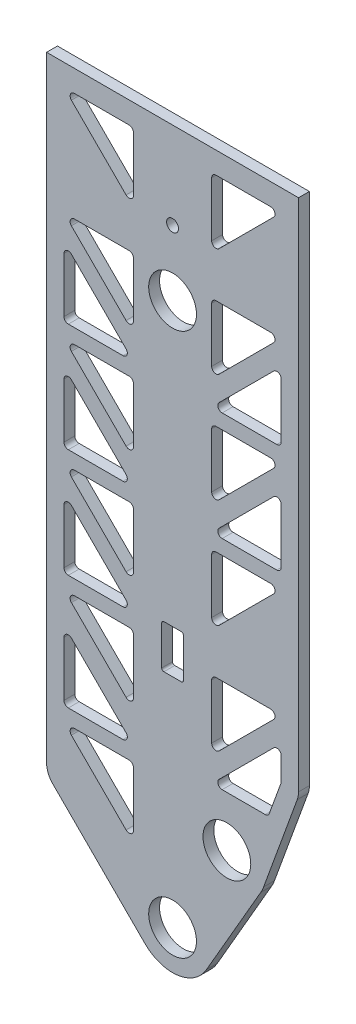
from build123d import *

# Parameters (mm, degrees)
SKETCH_1_R                  = 11
EXTRUDE_565_DEPTH           = 100
EXTRUDE_START               = -100
SKETCH_2_R                  = 11
EXTRUDE_874_DEPTH           = 100
EXTRUDE_2690_DEPTH          = 100
CUT_EXTRUDE_4147_DEPTH      = 534.010318849
CUT_EXTRUDE_4147_DEPTH_BACK = 534.010318849
SKETCH_3_W                  = 90
SKETCH_3_H                  = 380
SKETCH_5_R                  = 2.5
EXTRUDE_4713_DEPTH          = 100
SKETCH_6_W                  = 191.177045066
SKETCH_6_H                  = 235.084722287
CUT_EXTRUDE_5027_DEPTH      = 84
SKETCH_7_R                  = 75
EXTRUDE_5315_DEPTH          = 5
CUT_EXTRUDE_6097_DEPTH      = 357.195171219
CUT_EXTRUDE_6097_DEPTH_BACK = 357.195171219
FILLET_2_R                  = 2
MIRROR_START                = 95
MIRROR_1_DEPTH              = 5
CUT_EXTRUDE_START           = -5
CUT_EXTRUDE_12029_OUTLINE_R = 5
CUT_EXTRUDE_12029_DEPTH     = 5
CUT_EXTRUDE_7_DEPTH         = 357.195171219
CUT_EXTRUDE_7_DEPTH_BACK    = 357.195171219
SKETCH_14_W                 = 10
SKETCH_14_H                 = 20
FILLET_4_R                  = 1
CUT_EXTRUDE_START_2         = -129
SKETCH_15_R                 = 11
CUT_EXTRUDE_8_DEPTH         = 129
SKETCH_16_R                 = 13
CUT_EXTRUDE_9_DEPTH         = 0.75
SKETCH_18_R                 = 11
CUT_EXTRUDE_11_DEPTH        = 113
CUT_EXTRUDE_12_DEPTH        = 357.195171219
CUT_EXTRUDE_12_DEPTH_BACK   = 357.195171219
MOVE_FACE_1_BY              = 4
SKETCH_22_R                 = 2.75
CUT_EXTRUDE_14_DEPTH        = 22
FILLET_5_R                  = 10
MOVE_FACE_2_BY              = 4


# Read off the part's stored shape, not the designer's step: 镜向1, 电机安装轴承孔
with BuildPart() as part:
    # 草图1 → Extrude 565 (new body)
    with BuildSketch(Plane.XY):
        with BuildLine():
            Line((-18, 500), (-18, 0))
            ThreePointArc((-18, 0), (0, -18), (18, 0))
            Line((18, 0), (18, 500))
            ThreePointArc((18, 500), (0, 518), (-18, 500))
        make_face()
        with Locations((0, 500)):
            Circle(SKETCH_1_R, mode=Mode.SUBTRACT)
        Circle(SKETCH_1_R, mode=Mode.SUBTRACT)
    extrude(amount=EXTRUDE_565_DEPTH)

    # 草图2 → Extrude 874 (add)
    with BuildSketch(Plane.XY.offset(100).offset(EXTRUDE_START)):
        with BuildLine():
            Line((18, 61.301270189), (25, 61.301270189))
            ThreePointArc((25, 61.301270189), (40.588457268, 52.301270189), (40.588457268, 34.301270189))
            Line((40.588457268, 34.301270189), (15.588457268, -9))
            ThreePointArc((15.588457268, -9), (-4.658742812, -17.386664873), (-18, 0))
            Line((-18, 0), (-18, 61.301270189))
            Line((-18, 61.301270189), (18, 61.301270189))
        make_face()
        with Locations((25, 43.301270189)):
            Circle(SKETCH_2_R, mode=Mode.SUBTRACT)
        Circle(SKETCH_2_R, mode=Mode.SUBTRACT)
    extrude(amount=EXTRUDE_874_DEPTH)

    # 草图10 → Extrude 2690 (add)
    with BuildSketch(Plane(origin=(0, 0, 0), x_dir=(-1, 0, 0), z_dir=(0, 0, -1))):
        with BuildLine():
            Line((-41.914467174, 37.144907609), (-58, 81.339545828))
            Line((-58, 81.339545828), (-58, 320))
            Line((-58, 320), (-18, 320))
            Line((-18, 320), (-18, 61.301270189))
            Line((-18, 61.301270189), (-25, 61.301270189))
            ThreePointArc((-25, 61.301270189), (-39.744736797, 53.625646044), (-41.914467174, 37.144907609))
        make_face()
        with BuildLine():
            Line((12.727922061, -12.727922061), (58, 32.544155877))
            Line((58, 32.544155877), (58, 320))
            Line((58, 320), (18, 320))
            Line((18, 320), (18, 0))
            ThreePointArc((18, 0), (16.629831585, -6.888301783), (12.727922061, -12.727922061))
        make_face()
    extrude(amount=-EXTRUDE_2690_DEPTH)

    # 草图3 → Cut-Extrude 4147 (cut, two sides: drawn at the far end of the back side and taken through both)
    with BuildSketch(Plane.ZY.offset(18).offset(-CUT_EXTRUDE_4147_DEPTH_BACK)):
        with Locations((50, 150)):
            Rectangle(SKETCH_3_W, SKETCH_3_H)
    extrude(amount=CUT_EXTRUDE_4147_DEPTH + CUT_EXTRUDE_4147_DEPTH_BACK, mode=Mode.SUBTRACT)

    # 草图5 → Extrude 4713 (add)
    with BuildSketch(Plane.XY.offset(100)):
        with Locations(Location((0, 250, 0), (0, 0, 90))):
            Circle(SKETCH_5_R)
    extrude(amount=-EXTRUDE_4713_DEPTH)

    # 草图6 → Cut-Extrude 5027 (cut)
    with BuildSketch(Plane(origin=(18, 0, 0), x_dir=(0, 0, -1), z_dir=(1, 0, 0))):
        with Locations((-50.962374235, 437.542361144)):
            Rectangle(SKETCH_6_W, SKETCH_6_H)
    extrude(amount=-CUT_EXTRUDE_5027_DEPTH, mode=Mode.SUBTRACT)

    # 草图7 → Extrude 5315 (add)
    with BuildSketch(Plane(origin=(0, 320, 0), x_dir=(1, 0, 0), z_dir=(0, 1, 0))):
        with Locations(Location((0, -50, 0), (0, 0, 320.654170234))):
            Circle(SKETCH_7_R)
    extrude(amount=EXTRUDE_5315_DEPTH)

    # 草图10<3> → Cut-Extrude 6097 (cut, two sides: drawn at the far end of the back side and taken through both)
    with BuildSketch(Plane(origin=(0, 0, 0), x_dir=(-1, 0, 0), z_dir=(0, 0, -1)).offset(-CUT_EXTRUDE_6097_DEPTH_BACK)):
        Polygon((50, 310), (18, 310), (18, 278), align=None)
        Polygon((-18, 278), (-18, 310), (-50, 310), align=None)
        Polygon((-18, 227.925713543), (-18, 259.925713543), (-50, 259.925713543), align=None)
        Polygon((50, 259.925713543), (18, 259.925713543), (18, 227.925713543), align=None)
        Polygon((50, 248.612005044), (50, 216.612005044), (18, 216.612005044), align=None)
        Polygon((-50, 248.612005044), (-50, 216.612005044), (-18, 216.612005044), align=None)
        Polygon((-18, 177.851427085), (-18, 209.851427085), (-50, 209.851427085), align=None)
        Polygon((50, 209.851427085), (18, 209.851427085), (18, 177.851427085), align=None)
        Polygon((50, 198.537718586), (50, 166.537718586), (18, 166.537718586), align=None)
        Polygon((-50, 198.537718586), (-50, 166.537718586), (-18, 166.537718586), align=None)
        Polygon((-50, 159.777140628), (-18, 127.777140628), (-18, 159.777140628), align=None)
        Polygon((18, 159.777140628), (18, 127.777140628), (50, 159.777140628), align=None)
        Polygon((-50, 109.702854171), (-18, 77.702854171), (-18, 109.702854171), align=None)
        Polygon((18, 109.702854171), (18, 77.702854171), (50, 109.702854171), align=None)
        Polygon((-50, 98.389145672), (-50, 82.750161674), (-44.045077173, 66.389145672), (-18, 66.389145672), align=None)
        Polygon((18, 56.800140588), (18, 24.800140588), (50, 56.800140588), align=None)
        Polygon((50, 95.560718547), (50, 63.560718547), (18, 63.560718547), align=None)
        Polygon((50, 116.463432129), (18, 116.463432129), (50, 148.463432129), align=None)
    extrude(amount=CUT_EXTRUDE_6097_DEPTH + CUT_EXTRUDE_6097_DEPTH_BACK, mode=Mode.SUBTRACT)

    # 圆角2
    fillet_2_edges = [part.edges().sort_by_distance(p)[0] for p in [
        (50, 109.702854171, 2.5),
        (18, 109.702854171, 2.5),
        (18, 77.702854171, 2.5),
        (-18, 159.777140628, 2.5),
        (-50, 159.777140628, 2.5),
        (-18, 127.777140628, 2.5),
        (50, 159.777140628, 2.5),
        (18, 159.777140628, 2.5),
        (18, 127.777140628, 2.5),
        (50, 166.537718586, 2.5),
        (50, 198.537718586, 2.5),
        (18, 166.537718586, 2.5),
        (-50, 63.560718547, 2.5),
        (-18, 63.560718547, 2.5),
        (-50, 95.560718547, 2.5),
        (-50, 56.800140588, 2.5),
        (-18, 24.800140588, 2.5),
        (-18, 56.800140588, 2.5),
        (50, 82.750161674, 2.5),
        (50, 98.389145672, 2.5),
        (18, 66.389145672, 2.5),
        (44.045077173, 66.389145672, 2.5),
        (-18, 109.702854171, 2.5),
        (-50, 109.702854171, 2.5),
        (-18, 77.702854171, 2.5),
        (50, 310, 2.5),
        (18, 310, 2.5),
        (18, 278, 2.5),
        (50, 259.925713543, 2.5),
        (18, 259.925713543, 2.5),
        (18, 227.925713543, 2.5),
        (-50, 248.612005044, 2.5),
        (-50, 216.612005044, 2.5),
        (-18, 216.612005044, 2.5),
        (-18, 259.925713543, 2.5),
        (-50, 259.925713543, 2.5),
        (-18, 227.925713543, 2.5),
        (50, 216.612005044, 2.5),
        (50, 248.612005044, 2.5),
        (18, 216.612005044, 2.5),
        (50, 209.851427085, 2.5),
        (18, 209.851427085, 2.5),
        (18, 177.851427085, 2.5),
        (-50, 198.537718586, 2.5),
        (-50, 166.537718586, 2.5),
        (-18, 166.537718586, 2.5),
        (-18, 209.851427085, 2.5),
        (-50, 209.851427085, 2.5),
        (-18, 177.851427085, 2.5),
        (-50, 148.463432129, 2.5),
        (-50, 116.463432129, 2.5),
        (-18, 116.463432129, 2.5),
        (-18, 310, 2.5),
        (-50, 310, 2.5),
        (-18, 278, 2.5),
    ]]
    fillet(fillet_2_edges, radius=FILLET_2_R)

    # 镜向1 outline → 镜向1 (add)
    with BuildSketch(Plane.XY.offset(MIRROR_START)):
        with BuildLine():
            ThreePointArc((-50, 143.635005004), (-48.765366865, 145.482764069), (-46.585786438, 145.049218567))
            Line((-46.585786438, 145.049218567), (-50, 148.463432129))
            Line((-50, 148.463432129), (-50, 143.635005004))
        make_face()
        with BuildLine():
            Line((-18, 116.463432129), (-21.414213562, 119.877645691))
            ThreePointArc((-21.414213562, 119.877645691), (-20.98066806, 117.698065264), (-22.828427125, 116.463432129))
            Line((-22.828427125, 116.463432129), (-18, 116.463432129))
        make_face()
        with BuildLine():
            ThreePointArc((-48, 116.463432129), (-49.414213562, 117.049218567), (-50, 118.463432129))
            Line((-50, 118.463432129), (-50, 116.463432129))
            Line((-50, 116.463432129), (-48, 116.463432129))
        make_face()
        with BuildLine():
            ThreePointArc((-20, 310), (-18.585786438, 309.414213562), (-18, 308))
            Line((-18, 308), (-18, 310))
            Line((-18, 310), (-20, 310))
        make_face()
        with BuildLine():
            Line((-18, 278), (-18, 282.828427125))
            ThreePointArc((-18, 282.828427125), (-19.234633135, 280.98066806), (-21.414213562, 281.414213562))
            Line((-21.414213562, 281.414213562), (-18, 278))
        make_face()
        with BuildLine():
            ThreePointArc((-46.585786438, 306.585786438), (-47.01933194, 308.765366865), (-45.171572875, 310))
            Line((-45.171572875, 310), (-50, 310))
            Line((-50, 310), (-46.585786438, 306.585786438))
        make_face()
        with BuildLine():
            ThreePointArc((-20, 259.925713543), (-18.585786438, 259.339927105), (-18, 257.925713543))
            Line((-18, 257.925713543), (-18, 259.925713543))
            Line((-18, 259.925713543), (-20, 259.925713543))
        make_face()
        with BuildLine():
            Line((-18, 227.925713543), (-18, 232.754140667))
            ThreePointArc((-18, 232.754140667), (-19.234633135, 230.906381602), (-21.414213562, 231.339927105))
            Line((-21.414213562, 231.339927105), (-18, 227.925713543))
        make_face()
        with BuildLine():
            ThreePointArc((-46.585786438, 256.51149998), (-47.01933194, 258.691080407), (-45.171572875, 259.925713543))
            Line((-45.171572875, 259.925713543), (-50, 259.925713543))
            Line((-50, 259.925713543), (-46.585786438, 256.51149998))
        make_face()
        with BuildLine():
            ThreePointArc((-50, 243.783577919), (-48.765366865, 245.631336984), (-46.585786438, 245.197791481))
            Line((-46.585786438, 245.197791481), (-50, 248.612005044))
            Line((-50, 248.612005044), (-50, 243.783577919))
        make_face()
        with BuildLine():
            Line((-18, 216.612005044), (-21.414213562, 220.026218606))
            ThreePointArc((-21.414213562, 220.026218606), (-20.98066806, 217.846638179), (-22.828427125, 216.612005044))
            Line((-22.828427125, 216.612005044), (-18, 216.612005044))
        make_face()
        with BuildLine():
            ThreePointArc((-48, 216.612005044), (-49.414213563, 217.197791481), (-50, 218.612005044))
            Line((-50, 218.612005044), (-50, 216.612005044))
            Line((-50, 216.612005044), (-48, 216.612005044))
        make_face()
        with BuildLine():
            ThreePointArc((-20, 209.851427085), (-18.585786438, 209.265640647), (-18, 207.851427085))
            Line((-18, 207.851427085), (-18, 209.851427085))
            Line((-18, 209.851427085), (-20, 209.851427085))
        make_face()
        with BuildLine():
            Line((-18, 177.851427085), (-18, 182.67985421))
            ThreePointArc((-18, 182.67985421), (-19.234633135, 180.832095145), (-21.414213562, 181.265640648))
            Line((-21.414213562, 181.265640648), (-18, 177.851427085))
        make_face()
        with BuildLine():
            ThreePointArc((-46.585786438, 206.437213523), (-47.01933194, 208.61679395), (-45.171572875, 209.851427085))
            Line((-45.171572875, 209.851427085), (-50, 209.851427085))
            Line((-50, 209.851427085), (-46.585786438, 206.437213523))
        make_face()
        with BuildLine():
            ThreePointArc((-50, 193.709291462), (-48.765366865, 195.557050527), (-46.585786438, 195.123505024))
            Line((-46.585786438, 195.123505024), (-50, 198.537718586))
            Line((-50, 198.537718586), (-50, 193.709291462))
        make_face()
        with BuildLine():
            Line((-18, 166.537718586), (-21.414213562, 169.951932149))
            ThreePointArc((-21.414213562, 169.951932149), (-20.98066806, 167.772351722), (-22.828427125, 166.537718586))
            Line((-22.828427125, 166.537718586), (-18, 166.537718586))
        make_face()
        with BuildLine():
            ThreePointArc((-48, 166.537718586), (-49.414213562, 167.123505024), (-50, 168.537718586))
            Line((-50, 168.537718586), (-50, 166.537718586))
            Line((-50, 166.537718586), (-48, 166.537718586))
        make_face()
        with BuildLine():
            ThreePointArc((-20, 159.777140628), (-18.585786438, 159.19135419), (-18, 157.777140628))
            Line((-18, 157.777140628), (-18, 159.777140628))
            Line((-18, 159.777140628), (-20, 159.777140628))
        make_face()
        with BuildLine():
            Line((-18, 127.777140628), (-18, 132.605567753))
            ThreePointArc((-18, 132.605567753), (-19.234633135, 130.757808688), (-21.414213562, 131.19135419))
            Line((-21.414213562, 131.19135419), (-18, 127.777140628))
        make_face()
        with BuildLine():
            ThreePointArc((-46.585786438, 156.362927066), (-47.01933194, 158.542507493), (-45.171572875, 159.777140628))
            Line((-45.171572875, 159.777140628), (-50, 159.777140628))
            Line((-50, 159.777140628), (-46.585786438, 156.362927066))
        make_face()
        with BuildLine():
            ThreePointArc((-20, 109.702854171), (-18.585786438, 109.117067733), (-18, 107.702854171))
            Line((-18, 107.702854171), (-18, 109.702854171))
            Line((-18, 109.702854171), (-20, 109.702854171))
        make_face()
        with BuildLine():
            Line((-18, 77.702854171), (-18, 82.531281295))
            ThreePointArc((-18, 82.531281295), (-19.234633135, 80.68352223), (-21.414213562, 81.117067733))
            Line((-21.414213562, 81.117067733), (-18, 77.702854171))
        make_face()
        with BuildLine():
            ThreePointArc((-46.585786438, 106.288640608), (-47.01933194, 108.468221035), (-45.171572875, 109.702854171))
            Line((-45.171572875, 109.702854171), (-50, 109.702854171))
            Line((-50, 109.702854171), (-46.585786438, 106.288640608))
        make_face()
        with BuildLine():
            ThreePointArc((-50, 90.732291422), (-48.765366865, 92.580050487), (-46.585786438, 92.146504984))
            Line((-46.585786438, 92.146504984), (-50, 95.560718547))
            Line((-50, 95.560718547), (-50, 90.732291422))
        make_face()
        with BuildLine():
            Line((-18, 63.560718547), (-21.414213562, 66.974932109))
            ThreePointArc((-21.414213562, 66.974932109), (-20.98066806, 64.795351682), (-22.828427125, 63.560718547))
            Line((-22.828427125, 63.560718547), (-18, 63.560718547))
        make_face()
        with BuildLine():
            ThreePointArc((-48, 63.560718547), (-49.414213562, 64.146504984), (-50, 65.560718547))
            Line((-50, 65.560718547), (-50, 63.560718547))
            Line((-50, 63.560718547), (-48, 63.560718547))
        make_face()
        with BuildLine():
            ThreePointArc((-46.585786438, 53.385927026), (-47.01933194, 55.565507453), (-45.171572875, 56.800140588))
            Line((-45.171572875, 56.800140588), (-50, 56.800140588))
            Line((-50, 56.800140588), (-46.585786438, 53.385927026))
        make_face()
        with BuildLine():
            Line((-18, 56.800140588), (-20, 56.800140588))
            ThreePointArc((-20, 56.800140588), (-18.585786437, 56.214354151), (-18, 54.800140588))
            Line((-18, 54.800140588), (-18, 56.800140588))
        make_face()
        with BuildLine():
            ThreePointArc((-18, 29.628567713), (-19.234633135, 27.780808648), (-21.414213562, 28.214354151))
            Line((-21.414213562, 28.214354151), (-18, 24.800140588))
            Line((-18, 24.800140588), (-18, 29.628567713))
        make_face()
        with BuildLine():
            ThreePointArc((46.585786438, 94.974932109), (48.765366865, 95.408477612), (50, 93.560718547))
            Line((50, 93.560718547), (50, 98.389145672))
            Line((50, 98.389145672), (46.585786438, 94.974932109))
        make_face()
        with BuildLine():
            Line((50, 82.750161674), (50, 83.102815635))
            ThreePointArc((50, 83.102815635), (49.969615506, 82.75551928), (49.879385242, 82.418775349))
            Line((49.879385242, 82.418775349), (50, 82.750161674))
        make_face()
        with BuildLine():
            ThreePointArc((22.828427125, 66.389145672), (20.98066806, 67.623778807), (21.414213562, 69.803359234))
            Line((21.414213562, 69.803359234), (18, 66.389145672))
            Line((18, 66.389145672), (22.828427125, 66.389145672))
        make_face()
        with BuildLine():
            Line((44.045077173, 66.389145672), (44.524047338, 67.705105385))
            ThreePointArc((44.524047338, 67.705105385), (43.791814969, 66.750841583), (42.644662096, 66.389145672))
            Line((42.644662096, 66.389145672), (44.045077173, 66.389145672))
        make_face()
        with BuildLine():
            Line((18, 109.702854171), (18, 107.702854171))
            ThreePointArc((18, 107.702854171), (18.585786438, 109.117067733), (20, 109.702854171))
            Line((20, 109.702854171), (18, 109.702854171))
        make_face()
        with BuildLine():
            ThreePointArc((21.414213562, 81.117067733), (19.234633135, 80.68352223), (18, 82.531281295))
            Line((18, 82.531281295), (18, 77.702854171))
            Line((18, 77.702854171), (21.414213562, 81.117067733))
        make_face()
        with BuildLine():
            Line((50, 109.702854171), (45.171572875, 109.702854171))
            ThreePointArc((45.171572875, 109.702854171), (47.01933194, 108.468221035), (46.585786438, 106.288640608))
            Line((46.585786438, 106.288640608), (50, 109.702854171))
        make_face()
        with BuildLine():
            Line((18, 159.777140628), (18, 157.777140628))
            ThreePointArc((18, 157.777140628), (18.585786438, 159.19135419), (20, 159.777140628))
            Line((20, 159.777140628), (18, 159.777140628))
        make_face()
        with BuildLine():
            ThreePointArc((21.414213562, 131.19135419), (19.234633135, 130.757808688), (18, 132.605567753))
            Line((18, 132.605567753), (18, 127.777140628))
            Line((18, 127.777140628), (21.414213562, 131.19135419))
        make_face()
        with BuildLine():
            Line((50, 159.777140628), (45.171572875, 159.777140628))
            ThreePointArc((45.171572875, 159.777140628), (47.01933194, 158.542507493), (46.585786438, 156.362927066))
            Line((46.585786438, 156.362927066), (50, 159.777140628))
        make_face()
        with BuildLine():
            ThreePointArc((50, 168.537718586), (49.414213562, 167.123505024), (48, 166.537718586))
            Line((48, 166.537718586), (50, 166.537718586))
            Line((50, 166.537718586), (50, 168.537718586))
        make_face()
        with BuildLine():
            Line((18, 166.537718586), (22.828427125, 166.537718586))
            ThreePointArc((22.828427125, 166.537718586), (20.98066806, 167.772351722), (21.414213562, 169.951932149))
            Line((21.414213562, 169.951932149), (18, 166.537718586))
        make_face()
        with BuildLine():
            ThreePointArc((46.585786438, 195.123505024), (48.765366865, 195.557050527), (50, 193.709291462))
            Line((50, 193.709291462), (50, 198.537718586))
            Line((50, 198.537718586), (46.585786438, 195.123505024))
        make_face()
        with BuildLine():
            Line((18, 177.851427085), (21.414213562, 181.265640648))
            ThreePointArc((21.414213562, 181.265640648), (19.234633135, 180.832095145), (18, 182.67985421))
            Line((18, 182.67985421), (18, 177.851427085))
        make_face()
        with BuildLine():
            ThreePointArc((45.171572875, 209.851427085), (47.01933194, 208.61679395), (46.585786438, 206.437213523))
            Line((46.585786438, 206.437213523), (50, 209.851427085))
            Line((50, 209.851427085), (45.171572875, 209.851427085))
        make_face()
        with BuildLine():
            Line((18, 209.851427085), (18, 207.851427085))
            ThreePointArc((18, 207.851427085), (18.585786438, 209.265640647), (20, 209.851427085))
            Line((20, 209.851427085), (18, 209.851427085))
        make_face()
        with BuildLine():
            ThreePointArc((50, 218.612005044), (49.414213563, 217.197791481), (48, 216.612005044))
            Line((48, 216.612005044), (50, 216.612005044))
            Line((50, 216.612005044), (50, 218.612005044))
        make_face()
        with BuildLine():
            Line((18, 216.612005044), (22.828427125, 216.612005044))
            ThreePointArc((22.828427125, 216.612005044), (20.98066806, 217.846638179), (21.414213562, 220.026218606))
            Line((21.414213562, 220.026218606), (18, 216.612005044))
        make_face()
        with BuildLine():
            ThreePointArc((46.585786438, 245.197791481), (48.765366865, 245.631336984), (50, 243.783577919))
            Line((50, 243.783577919), (50, 248.612005044))
            Line((50, 248.612005044), (46.585786438, 245.197791481))
        make_face()
        with BuildLine():
            Line((18, 227.925713543), (21.414213562, 231.339927105))
            ThreePointArc((21.414213562, 231.339927105), (19.234633135, 230.906381602), (18, 232.754140667))
            Line((18, 232.754140667), (18, 227.925713543))
        make_face()
        with BuildLine():
            ThreePointArc((45.171572875, 259.925713543), (47.01933194, 258.691080407), (46.585786438, 256.51149998))
            Line((46.585786438, 256.51149998), (50, 259.925713543))
            Line((50, 259.925713543), (45.171572875, 259.925713543))
        make_face()
        with BuildLine():
            Line((18, 259.925713543), (18, 257.925713543))
            ThreePointArc((18, 257.925713543), (18.585786438, 259.339927105), (20, 259.925713543))
            Line((20, 259.925713543), (18, 259.925713543))
        make_face()
        with BuildLine():
            Line((18, 278), (21.414213562, 281.414213562))
            ThreePointArc((21.414213562, 281.414213562), (19.234633135, 280.98066806), (18, 282.828427125))
            Line((18, 282.828427125), (18, 278))
        make_face()
        with BuildLine():
            ThreePointArc((45.171572875, 310), (47.01933194, 308.765366865), (46.585786438, 306.585786438))
            Line((46.585786438, 306.585786438), (50, 310))
            Line((50, 310), (45.171572875, 310))
        make_face()
        with BuildLine():
            Line((18, 310), (18, 308))
            ThreePointArc((18, 308), (18.585786438, 309.414213562), (20, 310))
            Line((20, 310), (18, 310))
        make_face()
    extrude(amount=MIRROR_1_DEPTH)

    # Cut-Extrude 12029 outline → Cut-Extrude 12029 (cut)
    with BuildSketch(Plane.XY.offset(5).offset(CUT_EXTRUDE_START)):
        with Locations((0, 250)):
            Circle(CUT_EXTRUDE_12029_OUTLINE_R)
    cut_extrude_12029 = extrude(amount=CUT_EXTRUDE_12029_DEPTH, mode=Mode.SUBTRACT)

    # 镜向2: Cut-Extrude 12029 across plane
    add(cut_extrude_12029.mirror(Plane(origin=(0, 0, 50), x_dir=(1, 0, 0), z_dir=(0, 0, -1))), mode=Mode.SUBTRACT)

    # 草图14 → 切除-拉伸7 (cut, two sides: drawn at the far end of the back side and taken through both)
    with BuildSketch(Plane(origin=(0, 0, 0), x_dir=(-1, 0, 0), z_dir=(0, 0, -1)).offset(-CUT_EXTRUDE_7_DEPTH_BACK)):
        with Locations((0, 110)):
            Rectangle(SKETCH_14_W, SKETCH_14_H)
    extrude(amount=CUT_EXTRUDE_7_DEPTH + CUT_EXTRUDE_7_DEPTH_BACK, mode=Mode.SUBTRACT)

    # 圆角4
    fillet_4_edges = [part.edges().sort_by_distance(p)[0] for p in [
        (5, 100, 2.5),
        (5, 120, 2.5),
        (-5, 120, 2.5),
        (-5, 100, 2.5),
        (5, 100, 97.5),
        (5, 120, 97.5),
        (-5, 120, 97.5),
        (-5, 100, 97.5),
    ]]
    fillet(fillet_4_edges, radius=FILLET_4_R)

    # 草图15 → 切除-拉伸8 (cut)
    with BuildSketch(Plane.XY.offset(100).offset(CUT_EXTRUDE_START_2)):
        with Locations((25, 43.301270189)):
            Circle(SKETCH_15_R)
    extrude(amount=CUT_EXTRUDE_8_DEPTH, mode=Mode.SUBTRACT)

    # 草图16 → 切除-拉伸9 (cut)
    with BuildSketch(Plane.XY.offset(100)):
        with Locations((25, 43.301270189)):
            Circle(SKETCH_16_R)
        Circle(SKETCH_16_R)
    extrude(amount=-CUT_EXTRUDE_9_DEPTH, mode=Mode.SUBTRACT)

    # 草图18 → 切除-拉伸11 (cut)
    with BuildSketch(Plane.XY.offset(100)):
        with Locations((0, 250)):
            Circle(SKETCH_18_R)
    extrude(amount=-CUT_EXTRUDE_11_DEPTH, mode=Mode.SUBTRACT)

    # 草图20 → 切除-拉伸12 (cut, two sides: drawn at the far end of the back side and taken through both)
    with BuildSketch(Plane(origin=(0, 0, 0), x_dir=(0, 0, -1), z_dir=(1, 0, 0)).offset(-CUT_EXTRUDE_12_DEPTH_BACK)):
        Polygon((0, 320), (25, 320), (25, 325), (-125, 325), (-125, -65.067335994), (-50, -65.067335994), (-50, 320), align=None)
    extrude(amount=CUT_EXTRUDE_12_DEPTH + CUT_EXTRUDE_12_DEPTH_BACK, mode=Mode.SUBTRACT)

    # Move Face 1: a face moved outward by 4.0
    extrude(part.faces().sort_by_distance((-0.420282663, 164.716634525, 5))[0], amount=MOVE_FACE_1_BY, dir=(0, 0, 1))

    # 草图22 → 切除-拉伸14 (cut)
    with BuildSketch(Plane(origin=(0, 0, 0), x_dir=(-1, 0, 0), z_dir=(0, 0, -1))):
        with Locations((0, 280)):
            Circle(SKETCH_22_R)
    extrude(amount=-CUT_EXTRUDE_14_DEPTH, mode=Mode.SUBTRACT)

    # 圆角5
    fillet_5_edges = [part.edges().sort_by_distance(p)[0] for p in [
        (-58, 32.544155877, 4.5),
        (58, 81.339545828, 4.5),
    ]]
    fillet(fillet_5_edges, radius=FILLET_5_R)

    # Move Face 2: a face moved inward by 4.0
    extrude(part.faces().sort_by_distance((-0.416271326, 164.620803387, 9))[0], amount=MOVE_FACE_2_BY, dir=(0, 0, -1), mode=Mode.SUBTRACT)


solid = part.part
